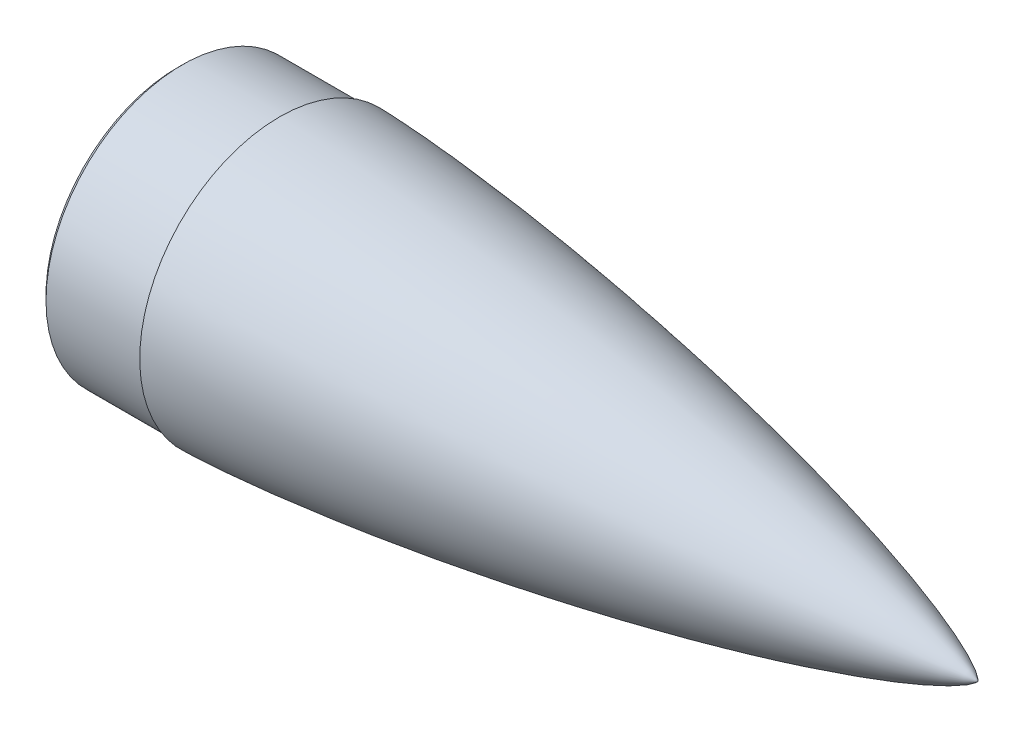
from build123d import *

# Parameters (mm, degrees)
CHAMFER1_SIZE = 3


with BuildPart() as part:
    # Sketch10 → Revolve1 (revolve)
    with BuildSketch(Plane.XY):
        with BuildLine():
            Line((10.405784251, 74), (-59.604687473, 74))
            Line((-59.604687473, 74), (-59.604687473, 80))
            Line((-59.604687473, 80), (0.395312527, 80))
            Line((0.395312527, 80), (0.395312527, 82))
            add(Edge.make_bspline(
                [(410, 0), (409.997496866, 0.013472153), (409.990301792, 0.039800524), (409.968165049, 0.090103358), (409.92284863, 0.173127162), (409.855672584, 0.273813365), (409.74938085, 0.412801662), (409.586485436, 0.600066322), (409.327754502, 0.864272898), (408.886911298, 1.261790265), (408.130802077, 1.862436943), (406.802221336, 2.787028577), (404.443171096, 4.219555546), (400.278934621, 6.413492144), (393.395858572, 9.556692069), (381.518163709, 14.280986327), (364.420194017, 20.156175425), (342.917172387, 26.658656039), (318.04643677, 33.376315325), (292.418468916, 39.670772984), (266.676665077, 45.480774082), (240.843900313, 50.869906905), (214.93416181, 55.875628987), (188.957486676, 60.520647521), (166.175141871, 64.278193354), (146.612803924, 67.279856873), (130.288753483, 69.63167706), (117.216602667, 71.421260832), (104.131788652, 73.115855139), (92.671671431, 74.511851657), (82.840989651, 75.642903089), (74.643621676, 76.539402432), (68.082638087, 77.22785357), (61.518564194, 77.886252075), (54.95138814, 78.513039978), (48.381108253, 79.106349334), (41.807700883, 79.663901215), (36.053205177, 80.117977042), (31.118782909, 80.480776125), (27.005411445, 80.763960915), (23.713894802, 80.978298659), (20.097064423, 81.19934178), (16.728563904, 81.388758488), (13.608602009, 81.548588329), (10.737373614, 81.681116681), (8.439959074, 81.777173717), (6.142106355, 81.862551346), (4.131086034, 81.925134159), (2.40706313, 81.969373159), (1.257538552, 81.989729362), (0.68273652, 81.998597247), (0.395312527, 82)],
                knots=[0, 0, 0, 0, 0, 0.000130123, 0.000260245, 0.000520491, 0.000900391, 0.00128029, 0.001925099, 0.002881508, 0.004418208, 0.006927086, 0.011110697, 0.018279138, 0.03067276, 0.051704469, 0.08310228, 0.139908797, 0.202702513, 0.265496165, 0.328289682, 0.391083359, 0.453876973, 0.516670577, 0.579464197, 0.642257765, 0.673654596, 0.705051427, 0.736448267, 0.767845106, 0.799241874, 0.814940257, 0.830638641, 0.846337073, 0.862035505, 0.877733936, 0.893432368, 0.90913072, 0.924829072, 0.932678248, 0.940527424, 0.9483766, 0.956225776, 0.967169332, 0.97264111, 0.978112888, 0.983584666, 0.989056444, 0.994528222, 0.997264111, 1, 1, 1, 1, 1], degree=4))
            Line((410, 0), (370, 0))
            add(Edge.make_bspline(
                [(370, 0), (369.997773082, 0.01229189), (369.991352721, 0.036334595), (369.971541011, 0.082349903), (369.931529373, 0.157248761), (369.872736003, 0.247494491), (369.780094465, 0.371744722), (369.637261442, 0.540398858), (369.408084539, 0.780572848), (369.015670593, 1.143240641), (368.339317586, 1.693244796), (367.151493407, 2.538674372), (365.038483235, 3.850357789), (361.326154317, 5.848779249), (355.237475953, 8.691296363), (344.780745558, 12.948575713), (329.768126115, 18.235928009), (310.906134386, 24.086883505), (289.081904039, 30.136875472), (266.587097715, 35.80912874), (243.987524879, 41.047275739), (221.304119749, 45.907812604), (198.549733098, 50.424041349), (175.733516131, 54.61608253), (155.720574577, 58.008137224), (138.534609492, 60.718410652), (124.192522972, 62.842273077), (112.706913801, 64.458586057), (101.209563095, 65.989281539), (91.139266308, 67.25038835), (82.500410966, 68.272222385), (75.296589797, 69.082186052), (69.530662099, 69.704194687), (63.7618618, 70.299052532), (57.990176661, 70.865336345), (52.215606448, 71.401343418), (46.438127488, 71.904984678), (41.380260665, 72.315076172), (37.043085832, 72.642625085), (33.427512086, 72.898212838), (30.53428839, 73.091559422), (27.378136768, 73.289451622), (23.958792246, 73.486583333), (20.769098037, 73.650713466), (17.809270279, 73.782896615), (15.342091062, 73.877238493), (13.614707397, 73.932869624), (12.13383007, 73.972254259), (11.146418605, 73.990612441), (10.652676949, 73.99862759), (10.405784251, 74)],
                knots=[0, 0, 0, 0, 0, 0.000134949, 0.000269899, 0.000539798, 0.000919537, 0.001299277, 0.001947431, 0.00293136, 0.004511869, 0.007081312, 0.011380263, 0.018707867, 0.031423867, 0.052705479, 0.084103008, 0.140910136, 0.203703492, 0.266497064, 0.329290816, 0.392084375, 0.454877964, 0.517671564, 0.580465191, 0.643258828, 0.674655593, 0.706052358, 0.737449114, 0.768845869, 0.800242661, 0.815941057, 0.831639453, 0.847337924, 0.863036395, 0.878734865, 0.894433336, 0.910131716, 0.925830096, 0.933679285, 0.941528475, 0.949377665, 0.957226855, 0.967920141, 0.978613427, 0.983960071, 0.989306714, 0.994653357, 0.997326678, 1, 1, 1, 1, 1], degree=4))
        make_face()
    revolve(axis=Axis((46.917858469, 0, 0), (-1, 0, 0)))

    # Chamfer1
    chamfer1_edges = [part.edges().sort_by_distance(p)[0] for p in [
        (-59.604687473, -80, 0),
    ]]
    chamfer(chamfer1_edges, length=CHAMFER1_SIZE)


solid = part.part
